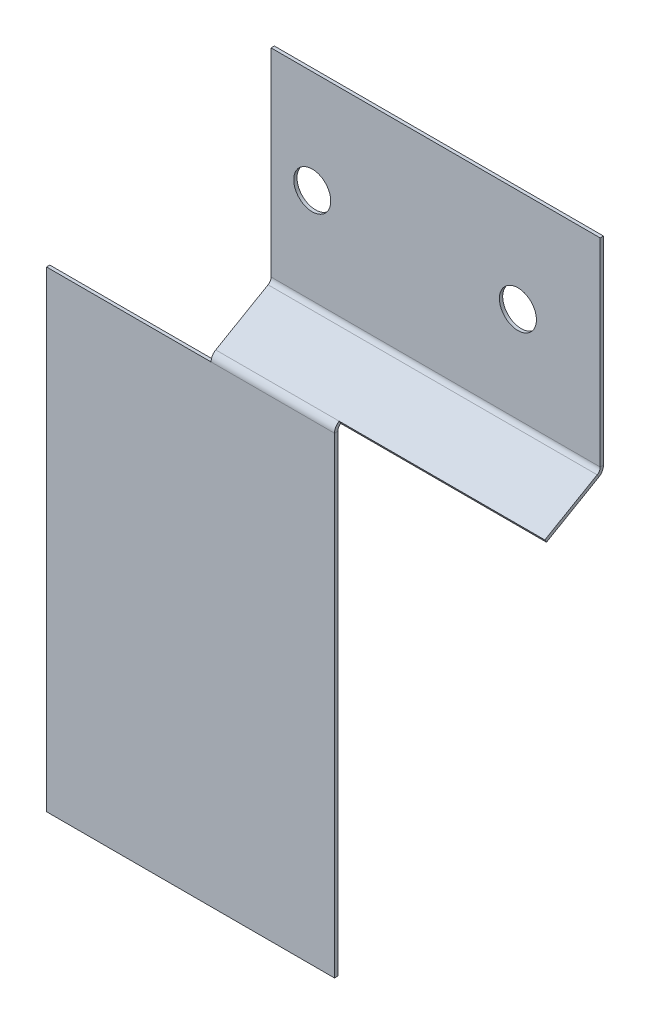
from build123d import *

# Parameters (mm, degrees)
SKETCH2_W               = 40
SKETCH2_H               = 25
SKETCH2_R               = 2.25
BASE_FLANGE1_DEPTH      = 0.4
EDGE_FLANGE1_DEPTH      = 40
EDGE_FLANGE1_2_DEPTH    = 40
EDGE_FLANGE2_DEPTH      = 15
EDGE_FLANGE2_START      = 0.4
EDGE_FLANGE2_PROFILE_W  = 35
EDGE_FLANGE2_PROFILE_H  = 57.343783684
EDGE_FLANGE2_FLAT_DEPTH = 0.4


# Read off the part's stored shape, not the designer's step: Edge-Flange1
# Sheet-metal steps are written as plain solids
with BuildPart() as part:
    # Sketch2 → Base-Flange1 (new body)
    with BuildSketch(Plane.XY):
        with Locations((20, 12.5)):
            Rectangle(SKETCH2_W, SKETCH2_H)
        with Locations((5, 12.5)):
            Circle(SKETCH2_R, mode=Mode.SUBTRACT)
        with Locations((30, 12.5)):
            Circle(SKETCH2_R, mode=Mode.SUBTRACT)
    extrude(amount=-BASE_FLANGE1_DEPTH)

    # Edge-Flange1 outline → Edge-Flange1 (cut)
    with BuildSketch(Plane.YZ):
        with BuildLine():
            ThreePointArc((0.887156424, -0.4), (0.410375552, -0.295165264), (0.021546812, 0))
            Line((0.021546812, 0), (0, 0))
            Line((0, 0), (0, -0.4))
            Line((0, -0.4), (0.887156424, -0.4))
        make_face()
    extrude(amount=EDGE_FLANGE1_DEPTH, mode=Mode.SUBTRACT)

    # Edge-Flange1 2 outline → Edge-Flange1 2 (add)
    with BuildSketch(Plane.YZ):
        with BuildLine():
            Line((-3.769059892, 6.52820323), (-0.09716805, 0.1683))
            ThreePointArc((-0.09716805, 0.1683), (-0.041630555, 0.081455507), (0.021546812, 0))
            Line((0.021546812, 0), (0.887156424, 0))
            ThreePointArc((0.887156424, 0), (0.518856424, 0.098685688), (0.249242111, 0.3683))
            Line((0.249242111, 0.3683), (-3.422649731, 6.72820323))
            Line((-3.422649731, 6.72820323), (-3.769059892, 6.52820323))
        make_face()
    extrude(amount=EDGE_FLANGE1_2_DEPTH)

    # Edge-Flange2 bend section (across the edge) → Edge-Flange2 (add)
    with BuildSketch(Plane(origin=(15, -3.981697996, 6.89650323), x_dir=(0, 0, -1), z_dir=(-1, 0, 0))):
        with BuildLine():
            Line((-0.4, 0.425276208), (0, 0.425276208))
            ThreePointArc((0, 0.425276208), (0.098685688, 0.056976208), (0.3683, -0.212638104))
            Line((0.3683, -0.212638104), (0.1683, -0.559048266))
            ThreePointArc((0.1683, -0.559048266), (-0.247724474, -0.143023792), (-0.4, 0.425276208))
        make_face()
    extrude(amount=EDGE_FLANGE2_DEPTH)

    # Edge-Flange2 profile (on flange) → Edge-Flange2 flat (add)
    with BuildSketch(Plane(origin=(0, -3.981697996, 6.89650323), x_dir=(-1, 0, 0), z_dir=(0, 0, 1)).offset(EDGE_FLANGE2_START)):
        with Locations((2.5, 29.09716805)):
            Rectangle(EDGE_FLANGE2_PROFILE_W, EDGE_FLANGE2_PROFILE_H)
    extrude(amount=-EDGE_FLANGE2_FLAT_DEPTH)


solid = part.part
